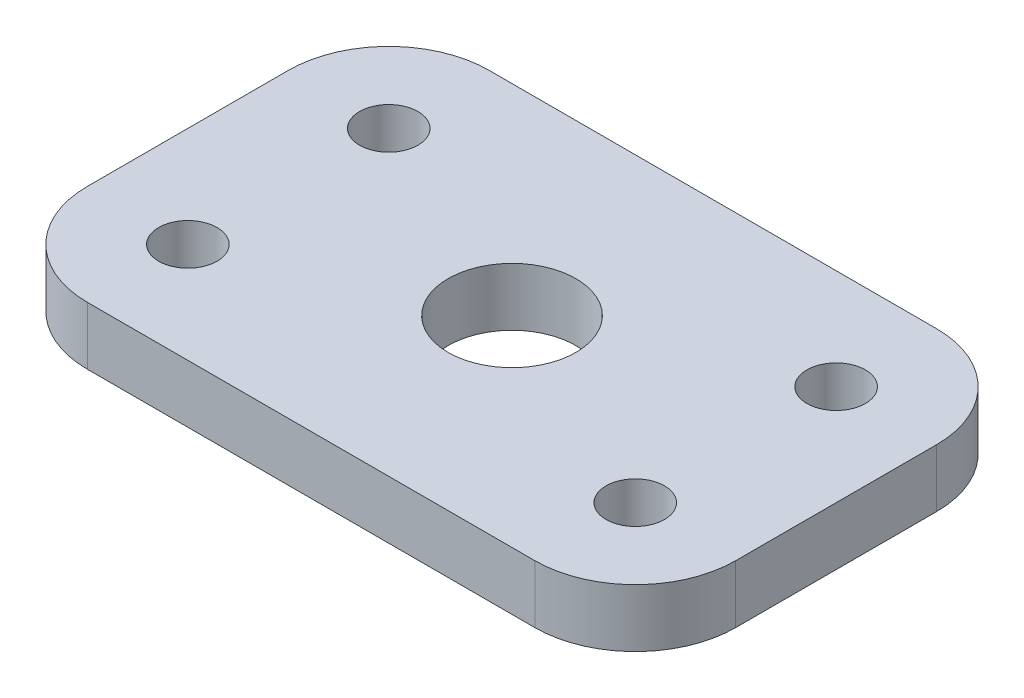
from build123d import *

# Parameters (mm, degrees)
SKETCH2_W             = 22
SKETCH2_H             = 17.825
SKETCH2_R             = 2.85
BOSS_EXTRUDE1_DEPTH   = 5.5
FILLET1_R             = 10
FILLET2_R             = 5.5
SKETCH4_R             = 2.55
CUT_EXTRUDE1_DEPTH    = 5.5
CHAMFER1_SIZE         = 0.4
CHAMFER1_SIZE2        = 1.098990968
CHAMFER4_SIZE         = 0.4
CHAMFER5_SIZE         = 0.4
CHAMFER5_SIZE2        = 1.098990968
BODY_MOVE_COPY1_ANGLE = 180
SKETCH5_W             = 35.5
SKETCH5_H             = 22
SKETCH5_R             = 1.6
SKETCH5_R_2           = 3.5
BOSS_EXTRUDE2_DEPTH   = 3.175
FILLET3_R             = 5.5


with BuildPart() as part:
    # Sketch2 → Boss-Extrude1 (new, symmetric)
    with BuildSketch(Plane(origin=(0, 0, 0), x_dir=(0, 0, -1), z_dir=(1, 0, 0))):
        with Locations((0, -2.0875)):
            Rectangle(SKETCH2_W, SKETCH2_H)
        Circle(SKETCH2_R, mode=Mode.SUBTRACT)
    extrude(amount=BOSS_EXTRUDE1_DEPTH, both=True)

    # Fillet1
    fillet1_edges = [part.edges().sort_by_distance(p)[0] for p in [
        (0, -11, -11),
        (0, -11, 11),
    ]]
    fillet(fillet1_edges, radius=FILLET1_R)

    # Fillet2
    fillet2_edges = [part.edges().sort_by_distance(p)[0] for p in [
        (-5.5, 2.9125, -11),
        (-5.5, -8.071067812, -8.071067812),
        (-5.5, -8.071067812, 8.071067812),
        (5.5, 2.9125, -11),
        (5.5, -8.071067812, -8.071067812),
        (5.5, -8.071067812, 8.071067812),
        (-5.5, 2.9125, 11),
        (5.5, 2.9125, 11),
        (-5.5, -11, 0),
        (5.5, -11, 0),
    ]]
    fillet(fillet2_edges, radius=FILLET2_R - 0.0001)  # a hair under: the kernel refuses the full size

    # Sketch4 → Cut-Extrude1 (cut)
    with BuildSketch(Plane(origin=(0, 6.825, 0), x_dir=(1, 0, 0), z_dir=(0, 1, 0))):
        with Locations(Location((0, 5.5, 0), (0, 0, 270))):
            Circle(SKETCH4_R)
        with Locations(Location((0, -5.5, 0), (0, 0, 270))):
            Circle(SKETCH4_R)
    extrude(amount=-CUT_EXTRUDE1_DEPTH, mode=Mode.SUBTRACT)

    # Chamfer1
    chamfer1_edges = [part.edges().sort_by_distance(p)[0] for p in [
        (-5.5, 0, 2.85),
    ]]
    chamfer1_side = [part.faces().sort_by_distance(p)[0] for p in [
        (-5.5, 6.659799367, 0),
    ]]
    chamfer(chamfer1_edges, length=CHAMFER1_SIZE, length2=CHAMFER1_SIZE2, reference=chamfer1_side[0])

    # Chamfer4
    chamfer4_edges = [part.edges().sort_by_distance(p)[0] for p in [
        (-5.5, 6.825, 0),
        (5.5, 6.825, 0),
        (3.889116586, 6.825, 9.389116586),
        (-3.889116586, 6.825, 9.389116586),
        (3.889116586, 6.825, -9.389116586),
        (-3.889116586, 6.825, -9.389116586),
    ]]
    chamfer(chamfer4_edges, length=CHAMFER4_SIZE)

    # Chamfer5
    chamfer5_edges = [part.edges().sort_by_distance(p)[0] for p in [
        (0, 6.825, -8.05),
        (0, 6.825, 2.95),
    ]]
    chamfer5_side = [part.faces().sort_by_distance(p)[0] for p in [
        (0, 6.825, 0),
    ]]
    chamfer(chamfer5_edges, length=CHAMFER5_SIZE, length2=CHAMFER5_SIZE2, reference=chamfer5_side[0])


with BuildPart() as body_2:
    # Body-Move/Copy1: copy of part
    add(part.part.rotate(Axis((0, 0, 0), (0, 1, 0)), BODY_MOVE_COPY1_ANGLE))


with BuildPart() as part_1:
    # Body-Move/Copy3: read off the stored shape, not the designer's step
    # Body-Move/Copy3: moved
    add(part.part.moved(Location((-24.5, 0, 0))))


with BuildPart() as body_3:
    # Sketch5 → Boss-Extrude2 (new body)
    with BuildSketch(Plane(origin=(0, 6.825, 0), x_dir=(1, 0, 0), z_dir=(0, 1, 0))):
        with Locations((-12.25, 0)):
            Rectangle(SKETCH5_W, SKETCH5_H)
        with Locations(Location((-24.5, 5.5, 0), (0, 0, 270))):
            Circle(SKETCH5_R, mode=Mode.SUBTRACT)
        with Locations(Location((0, -5.5, 0), (0, 0, 270))):
            Circle(SKETCH5_R, mode=Mode.SUBTRACT)
        with Locations(Location((0, 5.5, 0), (0, 0, 270))):
            Circle(SKETCH5_R, mode=Mode.SUBTRACT)
        with Locations(Location((-24.5, -5.5, 0), (0, 0, 270))):
            Circle(SKETCH5_R, mode=Mode.SUBTRACT)
        with Locations(Location((-12.25, 0, 0), (0, 0, 270))):
            Circle(SKETCH5_R_2, mode=Mode.SUBTRACT)
    extrude(amount=BOSS_EXTRUDE2_DEPTH)

    # Fillet3
    fillet3_edges = [body_3.edges().sort_by_distance(p)[0] for p in [
        (5.5, 8.4125, 11),
        (-30, 8.4125, 11),
        (-30, 8.4125, -11),
        (5.5, 8.4125, -11),
    ]]
    fillet(fillet3_edges, radius=FILLET3_R)


solid = body_3.part
